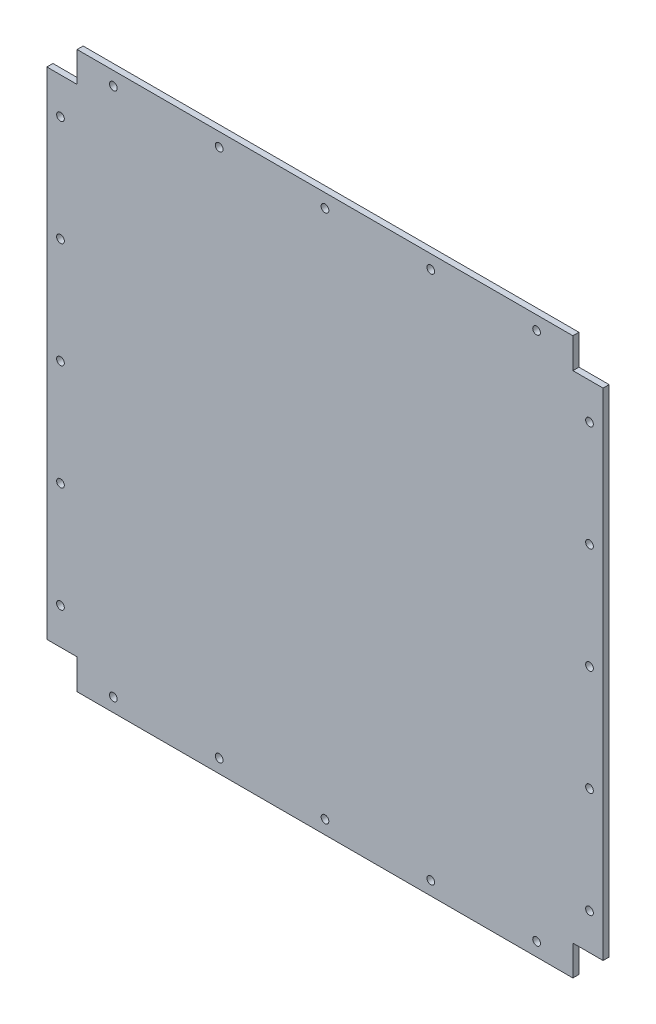
from build123d import *

# Parameters (mm, degrees)
SKETCH_1_W          = 368
SKETCH_1_H          = 368
EXTRUDE_1_DEPTH     = 4
SKETCH_3_R          = 2.55
CUT_EXTRUDE_2_DEPTH = 261.246037434
SKETCH_4_W          = 20
SKETCH_4_H          = 20
CUT_EXTRUDE_3_DEPTH = 261.246037434


with BuildPart() as part:
    # 草图1 → 凸台-拉伸1 (new body)
    with BuildSketch(Plane.XY):
        Rectangle(SKETCH_1_W, SKETCH_1_H)
    extrude(amount=EXTRUDE_1_DEPTH)

    # 草图3 → 切除-拉伸2 (cut, through all)
    with BuildSketch(Plane.XY.offset(4)):
        with Locations((0, -175)):
            Circle(SKETCH_3_R)
        with Locations((70, -175)):
            Circle(SKETCH_3_R)
        with Locations((140, -175)):
            Circle(SKETCH_3_R)
        with Locations((-70, -175)):
            Circle(SKETCH_3_R)
        with Locations((-140, -175)):
            Circle(SKETCH_3_R)
        with Locations((-175, 140)):
            Circle(SKETCH_3_R)
        with Locations((-175, 70)):
            Circle(SKETCH_3_R)
        with Locations((-175, -70)):
            Circle(SKETCH_3_R)
        with Locations((-175, -140)):
            Circle(SKETCH_3_R)
        with Locations((-175, 0)):
            Circle(SKETCH_3_R)
        with Locations((140, 175)):
            Circle(SKETCH_3_R)
        with Locations((70, 175)):
            Circle(SKETCH_3_R)
        with Locations((-70, 175)):
            Circle(SKETCH_3_R)
        with Locations((-140, 175)):
            Circle(SKETCH_3_R)
        with Locations((0, 175)):
            Circle(SKETCH_3_R)
        with Locations((175, -140)):
            Circle(SKETCH_3_R)
        with Locations((175, -70)):
            Circle(SKETCH_3_R)
        with Locations((175, 70)):
            Circle(SKETCH_3_R)
        with Locations((175, 140)):
            Circle(SKETCH_3_R)
        with Locations((175, 0)):
            Circle(SKETCH_3_R)
    extrude(amount=-CUT_EXTRUDE_2_DEPTH, mode=Mode.SUBTRACT)

    # 草图4 → 切除-拉伸3 (cut, through all)
    with BuildSketch(Plane.XY.offset(4)):
        with Locations((-174, 174)):
            Rectangle(SKETCH_4_W, SKETCH_4_H)
        with Locations((-174, -174)):
            Rectangle(SKETCH_4_W, SKETCH_4_H)
        with Locations((174, 174)):
            Rectangle(SKETCH_4_W, SKETCH_4_H)
        with Locations((174, -174)):
            Rectangle(SKETCH_4_W, SKETCH_4_H)
    extrude(amount=-CUT_EXTRUDE_3_DEPTH, mode=Mode.SUBTRACT)


solid = part.part
